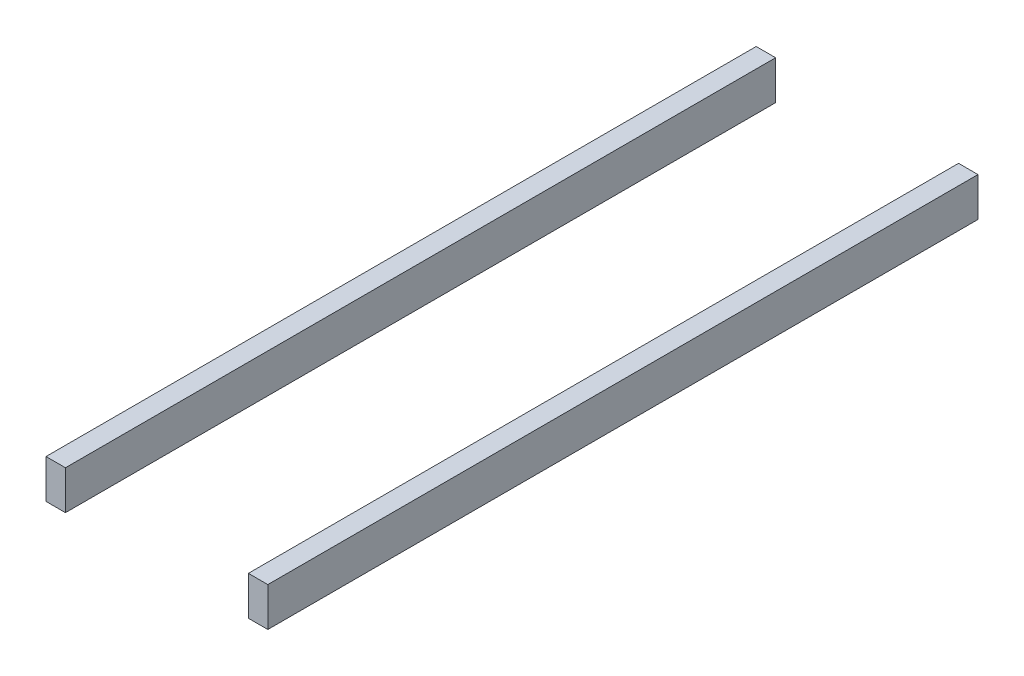
from build123d import *

# Parameters (mm, degrees)
SKETCH1_W             = 20
SKETCH1_H             = 730
BOSS_EXTRUDE1_DEPTH   = 20
BOSS_EXTRUDE1_2_DEPTH = 20


with BuildPart() as part:
    # Sketch1 → Boss-Extrude1 (new, symmetric)
    with BuildSketch(Plane(origin=(0, 0, 0), x_dir=(1, 0, 0), z_dir=(0, 1, 0))):
        with Locations((104, 0)):
            Rectangle(SKETCH1_W, SKETCH1_H)
    extrude(amount=BOSS_EXTRUDE1_DEPTH, both=True)


with BuildPart() as body_2:
    # Sketch1 → Boss-Extrude1 2 (new, symmetric)
    with BuildSketch(Plane(origin=(0, 0, 0), x_dir=(1, 0, 0), z_dir=(0, 1, 0))):
        with Locations((-104, 0)):
            Rectangle(SKETCH1_W, SKETCH1_H)
    extrude(amount=BOSS_EXTRUDE1_2_DEPTH, both=True)


solid = Compound([part.part, body_2.part])
